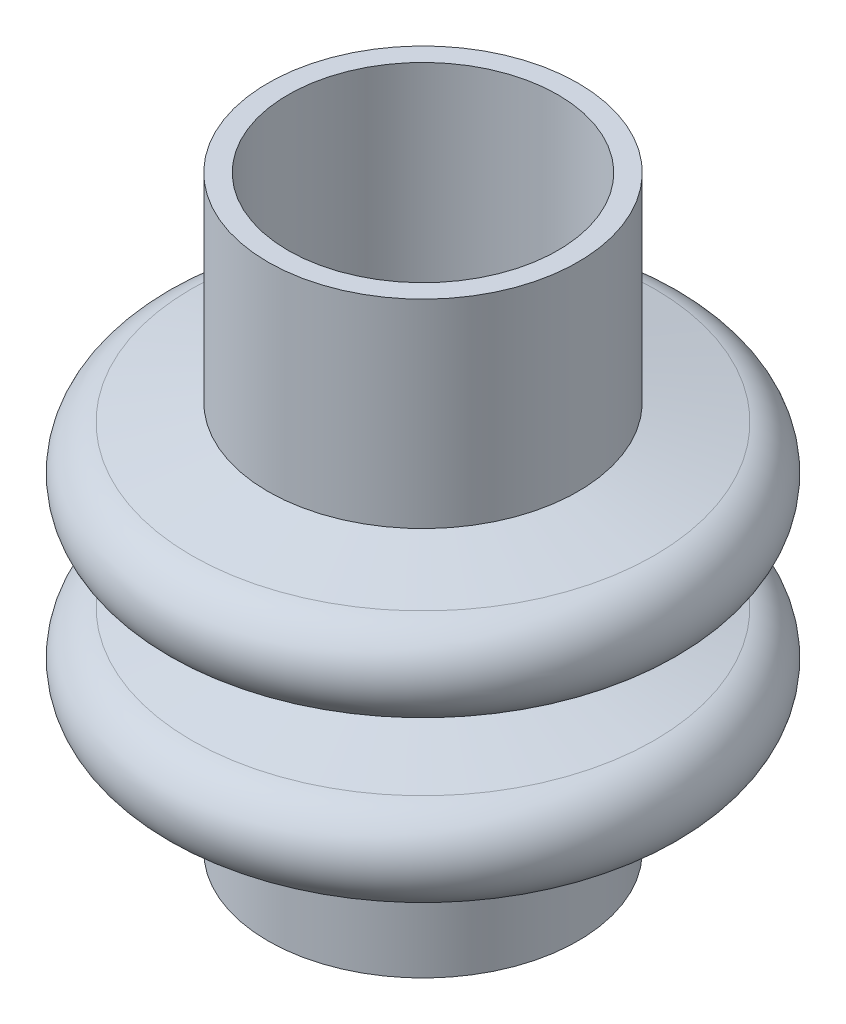
from build123d import *


# Read off the part's stored shape, not the designer's step: Thicken1
with BuildPart() as part:
    # Thicken1 outline → Thicken1 (revolve)
    with BuildSketch(Plane(origin=(-5.355704302, 0, 0), x_dir=(1, 0, 0), z_dir=(0, 0, 1))):
        with BuildLine():
            Line((5.355704302, -10.730973735), (5.355704302, -15.338446063))
            Line((5.355704302, -15.338446063), (6.155704302, -15.338446063))
            Line((6.155704302, -15.338446063), (6.155704302, -11.330639888))
            Line((6.155704302, -11.330639888), (9.28143381, -10.417156479))
            ThreePointArc((9.28143381, -10.417156479), (10.575723544, -8.636199454), (9.178416464, -6.934868574))
            Line((9.178416464, -6.934868574), (6.155704302, -6.242474301))
            Line((6.155704302, -6.242474301), (6.155704302, -4.975236163))
            Line((6.155704302, -4.975236163), (9.28143381, -4.061752754))
            ThreePointArc((9.28143381, -4.061752754), (10.575723544, -2.280795729), (9.178416464, -0.579464848))
            Line((9.178416464, -0.579464848), (6.155704302, 0.112929424))
            Line((6.155704302, 0.112929424), (6.155704302, 8))
            Line((6.155704302, 8), (5.355704302, 8))
            Line((5.355704302, 8), (5.355704302, -0.524539238))
            Line((5.355704302, -0.524539238), (8.99979167, -1.359268146))
            ThreePointArc((8.99979167, -1.359268146), (9.776073381, -2.304451968), (9.057023529, -3.293872538))
            Line((9.057023529, -3.293872538), (5.355704302, -4.375570009))
            Line((5.355704302, -4.375570009), (5.355704302, -6.879942964))
            Line((5.355704302, -6.879942964), (8.99979167, -7.714671871))
            ThreePointArc((8.99979167, -7.714671871), (9.776073381, -8.659855693), (9.057023529, -9.649276263))
            Line((9.057023529, -9.649276263), (5.355704302, -10.730973735))
        make_face()
    revolve(axis=Axis((-5.355704302, 0, 0), (0, 1, 0)))


solid = part.part
